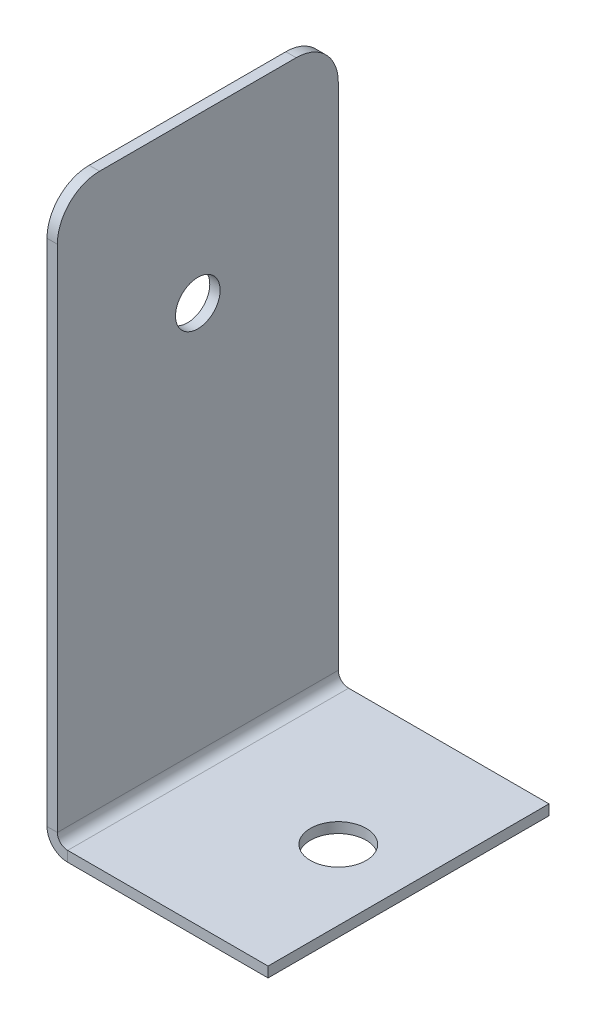
from build123d import *

# Parameters (mm, degrees)
BASE_FLANGE1_DEPTH      = 10
BASE_FLANGE1_DEPTH_BACK = 10
SKETCH6_R               = 1.5875
CUT_EXTRUDE1_DEPTH      = 10
SKETCH7_R               = 1.984375
CUT_EXTRUDE2_DEPTH      = 10
FILLET1_R               = 3


# Sheet-metal steps are written as plain solids
with BuildPart() as part:
    # Sketch1 → Base-Flange1 (new, two sides: drawn at the far end of the back side and taken through both)
    with BuildSketch(Plane.XY.offset(-BASE_FLANGE1_DEPTH_BACK)):
        with BuildLine():
            Line((0, 40), (0, 0.7366))
            ThreePointArc((0, 0.7366), (0.215745145, 0.215745145), (0.7366, 0))
            Line((0.7366, 0), (15, 0))
            Line((15, 0), (15, -0.7366))
            Line((15, -0.7366), (0.7366, -0.7366))
            ThreePointArc((0.7366, -0.7366), (-0.30510971, -0.30510971), (-0.7366, 0.7366))
            Line((-0.7366, 0.7366), (-0.7366, 40))
            Line((-0.7366, 40), (0, 40))
        make_face()
    extrude(amount=BASE_FLANGE1_DEPTH + BASE_FLANGE1_DEPTH_BACK)

    # Sketch6 → Cut-Extrude1 (cut)
    with BuildSketch(Plane(origin=(0, 0, 0), x_dir=(0, 0, -1), z_dir=(1, 0, 0))):
        with Locations(Location((0, 28.3734, 0), (0, 0, 90))):
            Circle(SKETCH6_R)
    extrude(amount=-CUT_EXTRUDE1_DEPTH, mode=Mode.SUBTRACT)

    # Sketch7 → Cut-Extrude2 (cut)
    with BuildSketch(Plane(origin=(0, 0, 0), x_dir=(1, 0, 0), z_dir=(0, 1, 0))):
        with Locations(Location((10, 0, 0), (0, 0, 270))):
            Circle(SKETCH7_R)
    extrude(amount=-CUT_EXTRUDE2_DEPTH, mode=Mode.SUBTRACT)

    # Fillet1
    fillet1_edges = [part.edges().sort_by_distance(p)[0] for p in [
        (-0.3683, 40, 10),
        (-0.3683, 40, -10),
    ]]
    fillet(fillet1_edges, radius=FILLET1_R)


solid = part.part
